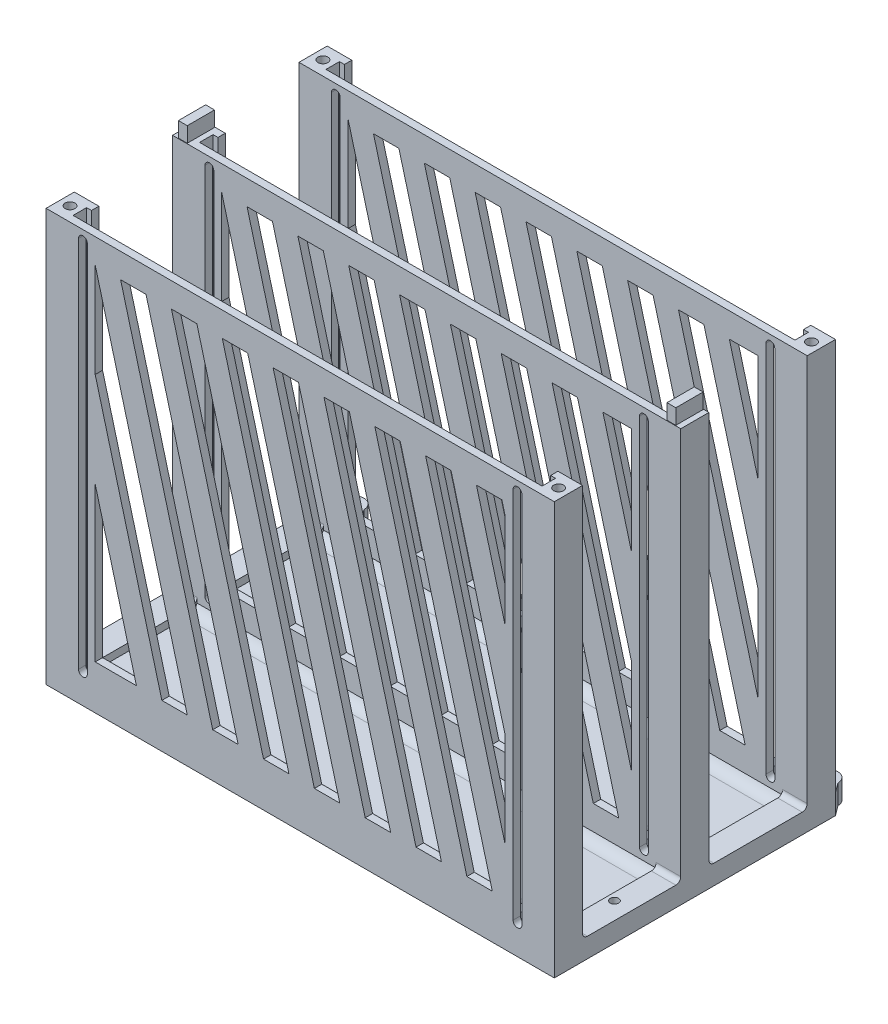
from build123d import *

# Parameters (mm, degrees)
SKETCH1_W             = 187
SKETCH1_H             = 3
SKETCH1_W_2           = 10
SKETCH1_H_2           = 40
BOSS_EXTRUDE1_DEPTH   = 3.2
BOSS_EXTRUDE2_DEPTH   = 160
BOSS_EXTRUDE3_START   = -3
SKETCH1_5_W           = 187
SKETCH1_5_H           = 3
SKETCH1_5_W_2         = 10
SKETCH1_5_H_2         = 40
BOSS_EXTRUDE3_DEPTH   = 5
FILLET1_R             = 5
SKETCH2_R             = 2
CUT_EXTRUDE1_DEPTH    = 5
FILLET2_R             = 2
BOSS_EXTRUDE4_START   = -3
SKETCH3_W             = 187
SKETCH3_H             = 160
BOSS_EXTRUDE4_DEPTH   = 3
SKETCH4_W             = 187
SKETCH4_H             = 160
BOSS_EXTRUDE5_DEPTH   = 3
LPATTERN1_COUNT       = 2
LPATTERN1_PITCH       = 51.5
SKETCH5_R             = 1.7
BASEPLATE_HOLES_DEPTH = 10
SKETCH2_4_W           = 3.6
SKETCH2_4_H           = 11.1
BOSS_EXTRUDE6_DEPTH   = 6.2
CUT_EXTRUDE3_START    = -106
CUT_EXTRUDE3_DEPTH    = 54.5
SKETCH1_6_R           = 4
SKETCH1_6_R_2         = 1.7
BASEPLATEHOLES2_DEPTH = 8


# Read off the part's stored shape, not the designer's step: Cut-Extrude3
with BuildPart() as part:
    # Sketch1 → Boss-Extrude1 (new body)
    with BuildSketch(Plane(origin=(0, 0, 0), x_dir=(1, 0, 0), z_dir=(0, 1, 0))):
        Polygon((-103.5, -108.75), (-93.5, -108.75), (-93.5, -105.75), (-95.5, -105.75), (-95.5, -100.25), (-93.5, -100.25), (-93.5, -97.25), (-103.5, -97.25), align=None)
        with Locations((0, -107.25)):
            Rectangle(SKETCH1_W, SKETCH1_H)
        with Locations((0, -98.75)):
            Rectangle(SKETCH1_W, SKETCH1_H)
        with Locations((0, -55.75)):
            Rectangle(SKETCH1_W, SKETCH1_H)
        Polygon((-103.5, -57.25), (-93.5, -57.25), (-93.5, -54.25), (-95.5, -54.25), (-95.5, -48.75), (-93.5, -48.75), (-93.5, -45.75), (-103.5, -45.75), align=None)
        with Locations((0, -47.25)):
            Rectangle(SKETCH1_W, SKETCH1_H)
        with Locations((0, -4.25)):
            Rectangle(SKETCH1_W, SKETCH1_H)
        with Locations((0, 4.25)):
            Rectangle(SKETCH1_W, SKETCH1_H)
        Polygon((93.5, -2.75), (95.5, -2.75), (95.5, 2.75), (93.5, 2.75), (93.5, 5.75), (103.5, 5.75), (103.5, -5.75), (93.5, -5.75), align=None)
        Polygon((103.5, -57.25), (93.5, -57.25), (93.5, -54.25), (95.5, -54.25), (95.5, -48.75), (93.5, -48.75), (93.5, -45.75), (103.5, -45.75), align=None)
        Polygon((103.5, -108.75), (93.5, -108.75), (93.5, -105.75), (95.5, -105.75), (95.5, -100.25), (93.5, -100.25), (93.5, -97.25), (103.5, -97.25), align=None)
        Polygon((-93.5, -5.75), (-93.5, -2.75), (-95.5, -2.75), (-95.5, 2.75), (-93.5, 2.75), (-93.5, 5.75), (-103.5, 5.75), (-103.5, -5.75), align=None)
        with Locations((-98.5, -77.25)):
            Rectangle(SKETCH1_W_2, SKETCH1_H_2)
        with Locations((-98.5, -25.75)):
            Rectangle(SKETCH1_W_2, SKETCH1_H_2)
        with Locations((98.5, -77.25)):
            Rectangle(SKETCH1_W_2, SKETCH1_H_2)
        with Locations((98.5, -25.75)):
            Rectangle(SKETCH1_W_2, SKETCH1_H_2)
    extrude(amount=-BOSS_EXTRUDE1_DEPTH)

    # Sketch1<4> → Boss-Extrude2 (add)
    with BuildSketch(Plane(origin=(0, 0, 0), x_dir=(1, 0, 0), z_dir=(0, 1, 0))):
        Polygon((-103.5, -108.75), (-93.5, -108.75), (-93.5, -105.75), (-95.5, -105.75), (-95.5, -100.25), (-93.5, -100.25), (-93.5, -97.25), (-103.5, -97.25), align=None)
        Polygon((-103.5, -57.25), (-93.5, -57.25), (-93.5, -54.25), (-95.5, -54.25), (-95.5, -48.75), (-93.5, -48.75), (-93.5, -45.75), (-103.5, -45.75), align=None)
        Polygon((-93.5, -5.75), (-93.5, -2.75), (-95.5, -2.75), (-95.5, 2.75), (-93.5, 2.75), (-93.5, 5.75), (-103.5, 5.75), (-103.5, -5.75), align=None)
        Polygon((103.5, -108.75), (93.5, -108.75), (93.5, -105.75), (95.5, -105.75), (95.5, -100.25), (93.5, -100.25), (93.5, -97.25), (103.5, -97.25), align=None)
        Polygon((103.5, -57.25), (93.5, -57.25), (93.5, -54.25), (95.5, -54.25), (95.5, -48.75), (93.5, -48.75), (93.5, -45.75), (103.5, -45.75), align=None)
        Polygon((93.5, -2.75), (95.5, -2.75), (95.5, 2.75), (93.5, 2.75), (93.5, 5.75), (103.5, 5.75), (103.5, -5.75), (93.5, -5.75), align=None)
    extrude(amount=BOSS_EXTRUDE2_DEPTH)

    # Sketch1<5> → Boss-Extrude3 (add)
    with BuildSketch(Plane(origin=(0, 0, 0), x_dir=(1, 0, 0), z_dir=(0, 1, 0)).offset(BOSS_EXTRUDE3_START)):
        Polygon((-103.5, -108.75), (-93.5, -108.75), (-93.5, -105.75), (-95.5, -105.75), (-95.5, -100.25), (-93.5, -100.25), (-93.5, -97.25), (-103.5, -97.25), align=None)
        with Locations((0, -107.25)):
            Rectangle(SKETCH1_5_W, SKETCH1_5_H)
        Polygon((-93.5, -105.75), (-95.5, -105.75), (-95.5, -100.25), (-93.5, -100.25), (93.5, -100.25), (95.5, -100.25), (95.5, -105.75), (93.5, -105.75), align=None)
        with Locations((0, -98.75)):
            Rectangle(SKETCH1_5_W, SKETCH1_5_H)
        with Locations((-98.5, -77.25)):
            Rectangle(SKETCH1_5_W_2, SKETCH1_5_H_2)
        Polygon((-103.5, -57.25), (-93.5, -57.25), (-93.5, -54.25), (-95.5, -54.25), (-95.5, -48.75), (-93.5, -48.75), (-93.5, -45.75), (-103.5, -45.75), align=None)
        with Locations((0, -55.75)):
            Rectangle(SKETCH1_5_W, SKETCH1_5_H)
        with Locations((0, -47.25)):
            Rectangle(SKETCH1_5_W, SKETCH1_5_H)
        with Locations((-98.5, -25.75)):
            Rectangle(SKETCH1_5_W_2, SKETCH1_5_H_2)
        Polygon((-93.5, -5.75), (-93.5, -2.75), (-95.5, -2.75), (-95.5, 2.75), (-93.5, 2.75), (-93.5, 5.75), (-103.5, 5.75), (-103.5, -5.75), align=None)
        with Locations((0, -4.25)):
            Rectangle(SKETCH1_5_W, SKETCH1_5_H)
        with Locations((0, 4.25)):
            Rectangle(SKETCH1_5_W, SKETCH1_5_H)
        Polygon((93.5, -2.75), (95.5, -2.75), (95.5, 2.75), (93.5, 2.75), (93.5, 5.75), (103.5, 5.75), (103.5, -5.75), (93.5, -5.75), align=None)
        with Locations((98.5, -25.75)):
            Rectangle(SKETCH1_5_W_2, SKETCH1_5_H_2)
        Polygon((103.5, -57.25), (93.5, -57.25), (93.5, -54.25), (95.5, -54.25), (95.5, -48.75), (93.5, -48.75), (93.5, -45.75), (103.5, -45.75), align=None)
        with Locations((98.5, -77.25)):
            Rectangle(SKETCH1_5_W_2, SKETCH1_5_H_2)
        Polygon((103.5, -108.75), (93.5, -108.75), (93.5, -105.75), (95.5, -105.75), (95.5, -100.25), (93.5, -100.25), (93.5, -97.25), (103.5, -97.25), align=None)
        Polygon((-93.5, -54.25), (-95.5, -54.25), (-95.5, -48.75), (-93.5, -48.75), (93.5, -48.75), (95.5, -48.75), (95.5, -54.25), (93.5, -54.25), align=None)
        Polygon((95.5, 2.75), (93.5, 2.75), (-93.5, 2.75), (-95.5, 2.75), (-95.5, -2.75), (-93.5, -2.75), (93.5, -2.75), (95.5, -2.75), align=None)
        with Locations((0, -77.25)):
            Rectangle(SKETCH1_5_W, SKETCH1_5_H_2)
        with Locations((0, -25.75)):
            Rectangle(SKETCH1_5_W, SKETCH1_5_H_2)
    extrude(amount=-BOSS_EXTRUDE3_DEPTH)

    # Fillet1
    # the kernel refuses this fillet: 5 mm, written as the material it adds along each edge
    with BuildSketch(Plane(origin=(-104.956439237, -3, 45.75), x_dir=(0, 1, 0), z_dir=(1, 0, 0))) as fillet1_piece_1_section:
        with BuildLine():
            CenterArc((5, -4.582575695), FILLET1_R, 113.578178478, 66.421821522)
            Line((0, -4.582575695), (-0.1, -4.582575695))
            Line((-0.1, -4.582575695), (-0.1, 0))
            Line((-0.1, 0), (0, 0.1))
            ThreePointArc((0, 0.1), (1.5, 0.1), (2.96, 0.091651514))
            Line((2.96, 0.091651514), (3, 0))
        make_face()
    fillet1_piece_1 = extrude(amount=209.912878475, mode=Mode.PRIVATE)
    fillet1_piece_1 = split(fillet1_piece_1, bisect_by=Plane(origin=(-103.5, -2.224183561, 44.634062279), z_dir=(1, 0, 0)), keep=Keep.TOP, mode=Mode.PRIVATE)
    fillet1_piece_1 = split(fillet1_piece_1, bisect_by=Plane(origin=(103.5, -2.224183561, 44.634062279), z_dir=(-1, 0, 0)), keep=Keep.TOP, mode=Mode.PRIVATE)
    add(fillet1_piece_1)
    with BuildSketch(Plane(origin=(-104.956439237, -3, 5.75), x_dir=(0, 0, 1), z_dir=(1, 0, 0))) as fillet1_piece_2_section:
        with BuildLine():
            CenterArc((4.582575695, -5), FILLET1_R, 90, 66.421821522)
            Line((0, -3), (-0.091651514, -2.96))
            ThreePointArc((-0.091651514, -2.96), (-0.1, -1.5), (-0.1, 0))
            Line((-0.1, 0), (0, 0.1))
            Line((0, 0.1), (4.582575695, 0.1))
            Line((4.582575695, 0.1), (4.582575695, 0))
        make_face()
    fillet1_piece_2 = extrude(amount=209.912878475, mode=Mode.PRIVATE)
    fillet1_piece_2 = split(fillet1_piece_2, bisect_by=Plane(origin=(-103.5, -2.224183561, 6.865937721), z_dir=(1, 0, 0)), keep=Keep.TOP, mode=Mode.PRIVATE)
    fillet1_piece_2 = split(fillet1_piece_2, bisect_by=Plane(origin=(103.5, -2.224183561, 6.865937721), z_dir=(-1, 0, 0)), keep=Keep.TOP, mode=Mode.PRIVATE)
    add(fillet1_piece_2)
    with BuildSketch(Plane(origin=(-104.956439237, -3, 57.25), x_dir=(0, 0, 1), z_dir=(1, 0, 0))) as fillet1_piece_3_section:
        with BuildLine():
            CenterArc((4.582575695, -5), FILLET1_R, 90, 66.421821522)
            Line((0, -3), (-0.091651514, -2.96))
            ThreePointArc((-0.091651514, -2.96), (-0.1, -1.5), (-0.1, 0))
            Line((-0.1, 0), (0, 0.1))
            Line((0, 0.1), (4.582575695, 0.1))
            Line((4.582575695, 0.1), (4.582575695, 0))
        make_face()
    fillet1_piece_3 = extrude(amount=209.912878475, mode=Mode.PRIVATE)
    fillet1_piece_3 = split(fillet1_piece_3, bisect_by=Plane(origin=(-103.5, -2.224183561, 58.365937721), z_dir=(1, 0, 0)), keep=Keep.TOP, mode=Mode.PRIVATE)
    fillet1_piece_3 = split(fillet1_piece_3, bisect_by=Plane(origin=(103.5, -2.224183561, 58.365937721), z_dir=(-1, 0, 0)), keep=Keep.TOP, mode=Mode.PRIVATE)
    add(fillet1_piece_3)
    with BuildSketch(Plane(origin=(-104.956439237, -3, 97.25), x_dir=(0, 1, 0), z_dir=(1, 0, 0))) as fillet1_piece_4_section:
        with BuildLine():
            CenterArc((5, -4.582575695), FILLET1_R, 113.578178478, 66.421821522)
            Line((0, -4.582575695), (-0.1, -4.582575695))
            Line((-0.1, -4.582575695), (-0.1, 0))
            Line((-0.1, 0), (0, 0.1))
            ThreePointArc((0, 0.1), (1.5, 0.1), (2.96, 0.091651514))
            Line((2.96, 0.091651514), (3, 0))
        make_face()
    fillet1_piece_4 = extrude(amount=209.912878475, mode=Mode.PRIVATE)
    fillet1_piece_4 = split(fillet1_piece_4, bisect_by=Plane(origin=(-103.5, -2.224183561, 96.134062279), z_dir=(1, 0, 0)), keep=Keep.TOP, mode=Mode.PRIVATE)
    fillet1_piece_4 = split(fillet1_piece_4, bisect_by=Plane(origin=(103.5, -2.224183561, 96.134062279), z_dir=(-1, 0, 0)), keep=Keep.TOP, mode=Mode.PRIVATE)
    add(fillet1_piece_4)

    # Sketch2 → Cut-Extrude1 (cut)
    with BuildSketch(Plane(origin=(0, 160, 0), x_dir=(1, 0, 0), z_dir=(0, 1, 0))):
        with Locations(Location((-99.5, 0, 0), (0, 0, 270))):
            Circle(SKETCH2_R)
        with Locations(Location((99.5, 0, 0), (0, 0, 270))):
            Circle(SKETCH2_R)
        with Locations(Location((99.5, -103, 0), (0, 0, 270))):
            Circle(SKETCH2_R)
        with Locations(Location((-99.5, -103, 0), (0, 0, 270))):
            Circle(SKETCH2_R)
    extrude(amount=-CUT_EXTRUDE1_DEPTH, mode=Mode.SUBTRACT)

    # Fillet2
    # the kernel refuses this fillet: 2 mm, written as the material it adds along each edge
    with BuildSketch(Plane(origin=(-103.5, 0, 57.25), x_dir=(0, 0, 1), z_dir=(1, 0, 0)), Plane(origin=(93.5, 0, 97.25), x_dir=(0, 1, 0), z_dir=(1, 0, 0)), Plane(origin=(93.5, 0, 45.75), x_dir=(0, 1, 0), z_dir=(1, 0, 0))) as fillet2_piece_1:
        with BuildLine():
            CenterArc((FILLET2_R, -FILLET2_R), FILLET2_R, 90, 90)
            Line((0, -FILLET2_R), (0, 0))
            Line((0, 0), (FILLET2_R, 0))
        make_face()
    extrude(amount=10)
    with BuildSketch(Plane(origin=(-93.5, 0, 45.75), x_dir=(0, 1, 0), z_dir=(-1, 0, 0)), Plane(origin=(-103.5, 0, 5.75), x_dir=(0, 1, 0), z_dir=(1, 0, 0)), Plane(origin=(103.5, 0, 57.25), x_dir=(0, 0, 1), z_dir=(-1, 0, 0)), Plane(origin=(103.5, 0, 5.75), x_dir=(0, 0, 1), z_dir=(-1, 0, 0)), Plane(origin=(-93.5, 0, 97.25), x_dir=(0, 1, 0), z_dir=(-1, 0, 0))) as fillet2_piece_2:
        with BuildLine():
            CenterArc((FILLET2_R, FILLET2_R), FILLET2_R, 180, 90)
            Line((0, FILLET2_R), (0, 0))
            Line((0, 0), (FILLET2_R, 0))
        make_face()
    extrude(amount=10)

    # Sketch3 → Boss-Extrude4 (add)
    with BuildSketch(Plane.XY.offset(108.75).offset(BOSS_EXTRUDE4_START)):
        with Locations((0, 80)):
            Rectangle(SKETCH3_W, SKETCH3_H)
        Polygon((-83.5, 10), (-83.5, 72.725933897), (-66.692636668, 10), align=None, mode=Mode.SUBTRACT)
        with BuildLine():
            Line((-90.3, 4), (-90.3, 156))
            ThreePointArc((-90.3, 156), (-88.5, 157.8), (-86.7, 156))
            Line((-86.7, 156), (-86.7, 4))
            ThreePointArc((-86.7, 4), (-88.5, 2.2), (-90.3, 4))
        make_face(mode=Mode.SUBTRACT)
        Polygon((-83.5, 150), (-45.98711306, 10), (-56.339874864, 10), (-83.5, 111.362966948), align=None, mode=Mode.SUBTRACT)
        Polygon((-35.634351256, 10), (-73.147238196, 150), (-62.794476392, 150), (-25.281589451, 10), align=None, mode=Mode.SUBTRACT)
        Polygon((-52.441714588, 150), (-42.088952784, 150), (-4.576065843, 10), (-14.928827647, 10), align=None, mode=Mode.SUBTRACT)
        Polygon((-31.736190979, 150), (-21.383429175, 150), (16.129457765, 10), (5.776695961, 10), align=None, mode=Mode.SUBTRACT)
        Polygon((-11.030667371, 150), (-0.677905567, 150), (36.834981373, 10), (26.482219569, 10), align=None, mode=Mode.SUBTRACT)
        Polygon((9.674856237, 150), (20.027618041, 150), (57.540504981, 10), (47.187743177, 10), align=None, mode=Mode.SUBTRACT)
        Polygon((30.380379845, 150), (40.733141649, 150), (78.24602859, 10), (67.893266785, 10), align=None, mode=Mode.SUBTRACT)
        Polygon((83.5, 29.028944806), (51.085903453, 150), (61.438665257, 150), (83.5, 67.665977858), align=None, mode=Mode.SUBTRACT)
        with BuildLine():
            Line((86.7, 4), (86.7, 17.086382222))
            Line((86.7, 17.086382222), (86.7, 156))
            ThreePointArc((86.7, 156), (88.5, 157.8), (90.3, 156))
            Line((90.3, 156), (90.3, 4))
            ThreePointArc((90.3, 4), (88.5, 2.2), (86.7, 4))
        make_face(mode=Mode.SUBTRACT)
        Polygon((71.791427062, 150), (82.144188866, 150), (83.5, 144.940043961), (83.5, 106.303010909), align=None, mode=Mode.SUBTRACT)
    extrude(amount=BOSS_EXTRUDE4_DEPTH)

    # Sketch4 → Boss-Extrude5 (add)
    with BuildSketch(Plane.XY.offset(57.25)):
        with Locations((0, 80)):
            Rectangle(SKETCH4_W, SKETCH4_H)
        Polygon((-83.5, 10), (-83.5, 72.725933897), (-66.692636668, 10), align=None, mode=Mode.SUBTRACT)
        Polygon((-83.5, 150), (-45.98711306, 10), (-56.339874864, 10), (-83.5, 111.362966948), align=None, mode=Mode.SUBTRACT)
        Polygon((-35.634351256, 10), (-73.147238196, 150), (-62.794476392, 150), (-25.281589451, 10), align=None, mode=Mode.SUBTRACT)
        Polygon((-52.441714588, 150), (-42.088952784, 150), (-4.576065843, 10), (-14.928827647, 10), align=None, mode=Mode.SUBTRACT)
        Polygon((-31.736190979, 150), (-21.383429175, 150), (16.129457765, 10), (5.776695961, 10), align=None, mode=Mode.SUBTRACT)
        Polygon((-11.030667371, 150), (-0.677905567, 150), (36.834981373, 10), (26.482219569, 10), align=None, mode=Mode.SUBTRACT)
        Polygon((9.674856237, 150), (20.027618041, 150), (57.540504981, 10), (47.187743177, 10), align=None, mode=Mode.SUBTRACT)
        Polygon((30.380379845, 150), (40.733141649, 150), (78.24602859, 10), (67.893266785, 10), align=None, mode=Mode.SUBTRACT)
        Polygon((51.085903453, 150), (61.438665257, 150), (83.5, 67.665977858), (83.5, 29.028944806), align=None, mode=Mode.SUBTRACT)
        Polygon((71.791427062, 150), (83.5, 150), (83.5, 106.303010909), align=None, mode=Mode.SUBTRACT)
    boss_extrude5 = extrude(amount=-BOSS_EXTRUDE5_DEPTH)

    # LPattern1: Boss-Extrude5 ×2
    with Locations(*[(0, 0, -i * LPATTERN1_PITCH) for i in range(1, LPATTERN1_COUNT)]):
        add(boss_extrude5)

    # Sketch5 → BASEPLATE HOLES (cut)
    with BuildSketch(Plane(origin=(0, 0, 0), x_dir=(1, 0, 0), z_dir=(0, 1, 0))):
        with Locations(Location((-96.5, -77.25, 0), (0, 0, 270))):
            Circle(SKETCH5_R)
        with Locations(Location((96.5, -77.25, 0), (0, 0, 270))):
            Circle(SKETCH5_R)
    extrude(amount=-BASEPLATE_HOLES_DEPTH, mode=Mode.SUBTRACT)

    # Sketch2<4> → Boss-Extrude6 (add)
    with BuildSketch(Plane(origin=(0, 160, 0), x_dir=(1, 0, 0), z_dir=(0, 1, 0))):
        with Locations((99.5, -51.5)):
            Rectangle(SKETCH2_4_W, SKETCH2_4_H)
        with Locations((-99.5, -51.5)):
            Rectangle(SKETCH2_4_W, SKETCH2_4_H)
    extrude(amount=BOSS_EXTRUDE6_DEPTH)

    # Cut-Extrude3 outline → Cut-Extrude3 (cut)
    with BuildSketch(Plane.XY.offset(108.75).offset(CUT_EXTRUDE3_START)):
        with BuildLine():
            ThreePointArc((-90.3, 4), (-88.5, 2.2), (-86.7, 4))
            Line((-86.7, 4), (-86.7, 156))
            ThreePointArc((-86.7, 156), (-88.5, 157.8), (-90.3, 156))
            Line((-90.3, 156), (-90.3, 4))
        make_face()
        with BuildLine():
            Line((86.7, 156), (86.7, 4))
            ThreePointArc((86.7, 4), (88.5, 2.2), (90.3, 4))
            Line((90.3, 4), (90.3, 156))
            ThreePointArc((90.3, 156), (88.5, 157.8), (86.7, 156))
        make_face()
    extrude(amount=CUT_EXTRUDE3_DEPTH, mode=Mode.SUBTRACT)

    # Sketch1<6> → BASEPLATEHOLES2 (add)
    # profile 1 of 6: a face of its own
    with BuildSketch(Plane(origin=(0, 0, 0), x_dir=(1, 0, 0), z_dir=(0, 1, 0))):
        with BuildLine():
            Line((-103.5, 5.75), (-96.5, 5.75))
            ThreePointArc((-96.5, 5.75), (-99.328427125, 6.921572875), (-100.5, 9.75))
            Line((-100.5, 9.75), (-103.5, 5.75))
        make_face()
    # profile 2 of 6: a face of its own
    with BuildSketch(Plane(origin=(0, 0, 0), x_dir=(1, 0, 0), z_dir=(0, 1, 0))):
        with Locations((-96.5, 9.75)):
            Circle(SKETCH1_6_R)
        with Locations(Location((-96.5, 9.75, 0), (0, 0, 270))):
            Circle(SKETCH1_6_R_2, mode=Mode.SUBTRACT)
    # profile 3 of 6: a face of its own
    with BuildSketch(Plane(origin=(0, 0, 0), x_dir=(1, 0, 0), z_dir=(0, 1, 0))):
        with BuildLine():
            Line((-96.5, 5.75), (-93.5, 5.75))
            Line((-93.5, 5.75), (-89.5, 5.75))
            Line((-89.5, 5.75), (-92.5, 9.75))
            ThreePointArc((-92.5, 9.75), (-93.671572875, 6.921572875), (-96.5, 5.75))
        make_face()
    # profile 4 of 6: a face of its own
    with BuildSketch(Plane(origin=(0, 0, 0), x_dir=(1, 0, 0), z_dir=(0, 1, 0))):
        with BuildLine():
            ThreePointArc((100.5, 9.75), (99.328427125, 6.921572875), (96.5, 5.75))
            Line((96.5, 5.75), (103.5, 5.75))
            Line((103.5, 5.75), (100.5, 9.75))
        make_face()
    # profile 5 of 6: a face of its own
    with BuildSketch(Plane(origin=(0, 0, 0), x_dir=(1, 0, 0), z_dir=(0, 1, 0))):
        with Locations((96.5, 9.75)):
            Circle(SKETCH1_6_R)
        with Locations(Location((96.5, 9.75, 0), (0, 0, 270))):
            Circle(SKETCH1_6_R_2, mode=Mode.SUBTRACT)
    # profile 6 of 6: a face of its own
    with BuildSketch(Plane(origin=(0, 0, 0), x_dir=(1, 0, 0), z_dir=(0, 1, 0))):
        with BuildLine():
            Line((89.5, 5.75), (93.5, 5.75))
            Line((93.5, 5.75), (96.5, 5.75))
            ThreePointArc((96.5, 5.75), (93.671572875, 6.921572875), (92.5, 9.75))
            Line((92.5, 9.75), (89.5, 5.75))
        make_face()
    extrude(amount=-BASEPLATEHOLES2_DEPTH)


solid = part.part
